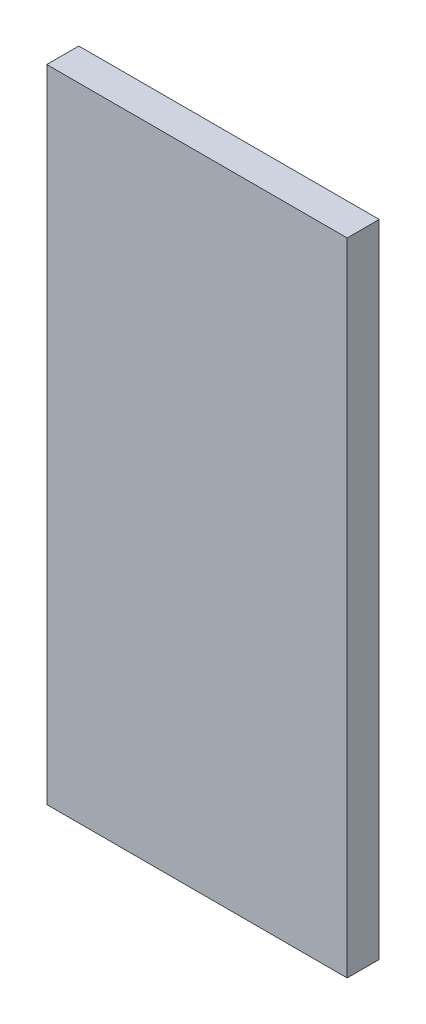
from build123d import *

# Parameters (mm, degrees)
SKETCH_1_W             = 75
SKETCH_1_H             = 160
SM_BASE_FLANGE_1_DEPTH = 8


# Sheet-metal steps are written as plain solids
with BuildPart() as part:
    # Sketch 1 → Базовая кромка1 (new body)
    with BuildSketch(Plane.XY):
        with Locations((37.5, -80)):
            Rectangle(SKETCH_1_W, SKETCH_1_H)
    extrude(amount=-SM_BASE_FLANGE_1_DEPTH)


solid = part.part
